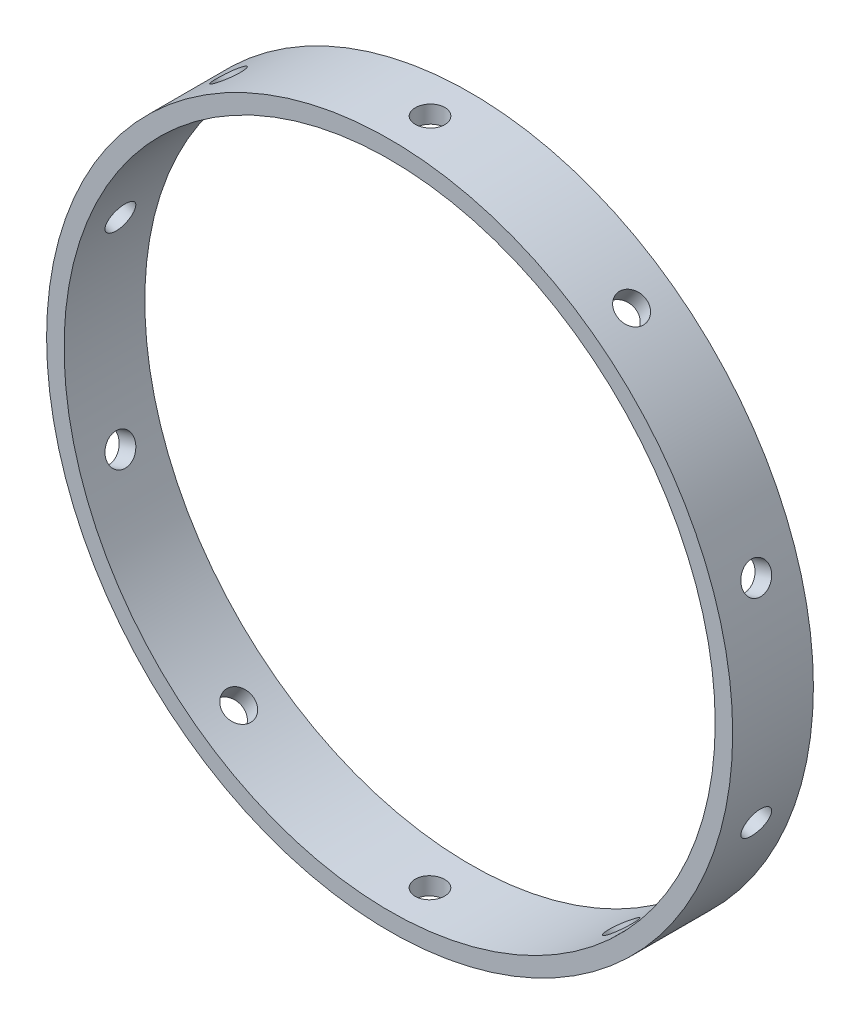
from build123d import *

# Parameters (mm, degrees)
SKETCH1_R           = 80.9625
SKETCH1_R_2         = 76.835
BOSS_EXTRUDE1_DEPTH = 19.05
SKETCH2_R           = 3.478244762
CUT_EXTRUDE1_DEPTH  = 117.072198706
CIRPATTERN1_COUNT   = 10


with BuildPart() as part:
    # Sketch1 → Boss-Extrude1 (new body)
    with BuildSketch(Plane.XY):
        Circle(SKETCH1_R)
        Circle(SKETCH1_R_2, mode=Mode.SUBTRACT)
    extrude(amount=BOSS_EXTRUDE1_DEPTH)

    # Sketch2 → Cut-Extrude1 (cut, through all)
    with BuildSketch(Plane(origin=(0, 0, 0), x_dir=(1, 0, 0), z_dir=(0, 1, 0))):
        with Locations((0, -9.525)):
            Circle(SKETCH2_R)
    cut_extrude1 = extrude(amount=-CUT_EXTRUDE1_DEPTH, mode=Mode.SUBTRACT)

    # CirPattern1: Cut-Extrude1 ×10 about axis
    cirpattern1_axis = Axis((0, 0, 2.080715754), (0, 0, 1))
    for i in range(1, CIRPATTERN1_COUNT):
        add(cut_extrude1.rotate(cirpattern1_axis, i * 360 / CIRPATTERN1_COUNT), mode=Mode.SUBTRACT)


solid = part.part
